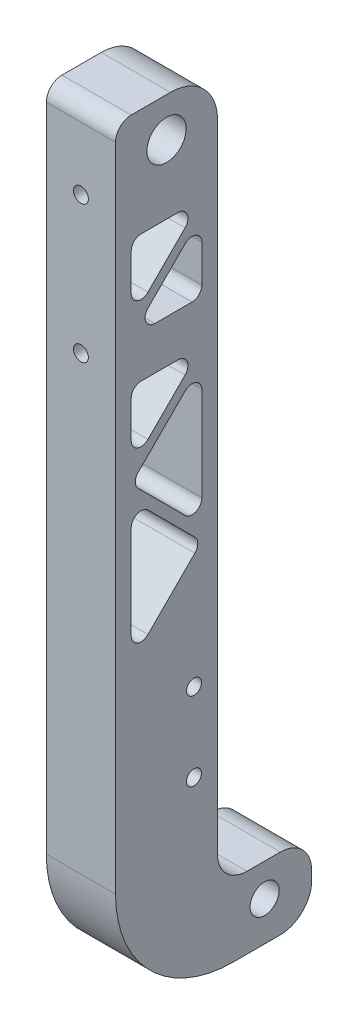
from build123d import *

# Parameters (mm, degrees)
SKETCH3_W               = 50.8
SKETCH3_H               = 254
BOSS_EXTRUDE1_DEPTH     = 25.4
SKETCH4_R               = 4.7117
CUT_EXTRUDE1_DEPTH      = 246.225128402
SKETCH5_R               = 2.413
CUT_EXTRUDE2_DEPTH      = 246.225128402
SKETCH6_W               = 45.72
SKETCH6_H               = 85.725
CUT_EXTRUDE3_DEPTH      = 246.225128402
SKETCH7_W               = 15.24
SKETCH7_H               = 85.725
CUT_EXTRUDE4_DEPTH      = 1.4986
SKETCH8_W               = 15.24
SKETCH8_H               = 85.725
CUT_EXTRUDE5_DEPTH      = 1.4986
SKETCH9_W               = 30.48
SKETCH9_H               = 230.759
CUT_EXTRUDE6_DEPTH      = 246.225128402
FILLET5_R               = 6.35
SKETCH14_W              = 25.4
SKETCH14_H              = 254
BOSS_EXTRUDE2_DEPTH     = 12.7
FILLET8_R               = 38.1
FILLET9_R               = 9.525
FILLET10_R              = 10.16
FILLET11_R              = 15.24
FILLET12_R              = 5.08
SKETCH18_R              = 2.413
CUT_EXTRUDE8_DEPTH      = 251.804904258
CUT_EXTRUDE9_DEPTH      = 248.386090151
FILLET13_R              = 3.175
SKETCH20_R              = 6.35
CUT_EXTRUDE10_DEPTH     = 248.386090151
CUT_EXTRUDE11_START     = -254
CUT_EXTRUDE11_OUTLINE_W = 1.4986
CUT_EXTRUDE11_OUTLINE_H = 63.5
CUT_EXTRUDE11_DEPTH     = 254


# Read off the part's stored shape, not the designer's step: Cut-Extrude11
with BuildPart() as part:
    # Sketch3 → Boss-Extrude1 (new body)
    with BuildSketch(Plane(origin=(0, 0, 0), x_dir=(0, 0, -1), z_dir=(1, 0, 0))):
        with Locations((-10.16, 114.3)):
            Rectangle(SKETCH3_W, SKETCH3_H)
    extrude(amount=BOSS_EXTRUDE1_DEPTH)

    # Sketch4 → Cut-Extrude1 (cut, through all)
    with BuildSketch(Plane(origin=(0, 0, 0), x_dir=(0, 0, -1), z_dir=(1, 0, 0))):
        Circle(SKETCH4_R)
    extrude(amount=CUT_EXTRUDE1_DEPTH, mode=Mode.SUBTRACT)

    # Sketch5 → Cut-Extrude2 (cut, through all)
    with BuildSketch(Plane(origin=(0, 0, 0), x_dir=(0, 0, -1), z_dir=(1, 0, 0))):
        with Locations((-22.86, 70.866)):
            Circle(SKETCH5_R)
        with Locations((-22.86, 45.466)):
            Circle(SKETCH5_R)
    extrude(amount=CUT_EXTRUDE2_DEPTH, mode=Mode.SUBTRACT)

    # Sketch6 → Cut-Extrude3 (cut, through all)
    with BuildSketch(Plane(origin=(0, 0, 0), x_dir=(0, 0, -1), z_dir=(1, 0, 0))):
        with Locations((7.62, 53.4035)):
            Rectangle(SKETCH6_W, SKETCH6_H)
    extrude(amount=CUT_EXTRUDE3_DEPTH, mode=Mode.SUBTRACT)

    # Sketch7 → Cut-Extrude4 (cut)
    with BuildSketch(Plane(origin=(25.4, 0, 0), x_dir=(0, 0, -1), z_dir=(1, 0, 0))):
        with Locations((-22.86, 53.4035)):
            Rectangle(SKETCH7_W, SKETCH7_H)
    extrude(amount=-CUT_EXTRUDE4_DEPTH, mode=Mode.SUBTRACT)

    # Sketch8 → Cut-Extrude5 (cut)
    with BuildSketch(Plane.ZY):
        with Locations((22.86, 53.4035)):
            Rectangle(SKETCH8_W, SKETCH8_H)
    extrude(amount=-CUT_EXTRUDE5_DEPTH, mode=Mode.SUBTRACT)

    # Sketch9 → Cut-Extrude6 (cut, through all)
    with BuildSketch(Plane(origin=(25.4, 0, 0), x_dir=(0, 0, -1), z_dir=(1, 0, 0))):
        with Locations((0, 125.9205)):
            Rectangle(SKETCH9_W, SKETCH9_H)
    extrude(amount=-CUT_EXTRUDE6_DEPTH, mode=Mode.SUBTRACT)

    # Fillet5
    fillet5_edges = [part.edges().sort_by_distance(p)[0] for p in [
        (24.6507, 10.541, 30.48),
        (24.6507, 96.266, 30.48),
        (0.7493, 96.266, 30.48),
        (0.7493, 10.541, 30.48),
    ]]
    fillet(fillet5_edges, radius=FILLET5_R)

    # Sketch14 → Boss-Extrude2 (add)
    with BuildSketch(Plane.XY.offset(35.56)):
        with Locations((12.7, 114.3)):
            Rectangle(SKETCH14_W, SKETCH14_H)
    extrude(amount=BOSS_EXTRUDE2_DEPTH)

    # Fillet8
    fillet8_edges = [part.edges().sort_by_distance(p)[0] for p in [
        (12.7, -12.7, 48.26),
    ]]
    fillet(fillet8_edges, radius=FILLET8_R)

    # Fillet9
    fillet9_edges = [part.edges().sort_by_distance(p)[0] for p in [
        (12.7, 10.541, 15.24),
    ]]
    fillet(fillet9_edges, radius=FILLET9_R)

    # Fillet10
    fillet10_edges = [part.edges().sort_by_distance(p)[0] for p in [
        (12.7, 10.541, -15.24),
        (12.7, -12.7, -15.24),
    ]]
    fillet(fillet10_edges, radius=FILLET10_R)

    # Fillet11
    fillet11_edges = [part.edges().sort_by_distance(p)[0] for p in [
        (12.7, 241.3, 15.24),
    ]]
    fillet(fillet11_edges, radius=FILLET11_R)

    # Fillet12
    fillet12_edges = [part.edges().sort_by_distance(p)[0] for p in [
        (12.7, 241.3, 48.26),
    ]]
    fillet(fillet12_edges, radius=FILLET12_R)

    # Sketch18 → Cut-Extrude8 (cut, through all)
    with BuildSketch(Plane.XY.offset(48.26)):
        with Locations((12.7, 215.9)):
            Circle(SKETCH18_R)
        with Locations((12.7, 171.45)):
            Circle(SKETCH18_R)
    extrude(amount=-CUT_EXTRUDE8_DEPTH, mode=Mode.SUBTRACT)

    # Sketch19 → Cut-Extrude9 (cut, through all)
    with BuildSketch(Plane(origin=(25.4, 0, 0), x_dir=(0, 0, -1), z_dir=(1, 0, 0))):
        Polygon((-20.32, 110.399743879), (-43.18, 133.259743879), (-43.18, 110.399743879), (-43.18, 87.539743879), align=None)
        Polygon((-43.18, 137.749871939), (-20.32, 114.889871939), (-20.32, 160.609871939), align=None)
        Polygon((-43.18, 165.1), (-20.32, 165.1), (-43.18, 142.24), align=None)
        Polygon((-43.18, 206.375), (-20.32, 206.375), (-43.18, 183.515), align=None)
        Polygon((-43.18, 179.024871939), (-20.32, 201.884871939), (-20.32, 179.024871939), align=None)
    extrude(amount=-CUT_EXTRUDE9_DEPTH, mode=Mode.SUBTRACT)

    # Fillet13
    fillet13_edges = [part.edges().sort_by_distance(p)[0] for p in [
        (12.7, 87.539743879, 43.18),
        (12.7, 133.259743879, 43.18),
        (12.7, 110.399743879, 20.32),
        (12.7, 137.749871939, 43.18),
        (12.7, 160.609871939, 20.32),
        (12.7, 114.889871939, 20.32),
        (12.7, 142.24, 43.18),
        (12.7, 165.1, 43.18),
        (12.7, 165.1, 20.32),
        (12.7, 183.515, 43.18),
        (12.7, 206.375, 43.18),
        (12.7, 206.375, 20.32),
        (12.7, 179.024871939, 20.32),
        (12.7, 179.024871939, 43.18),
        (12.7, 201.884871939, 20.32),
    ]]
    fillet(fillet13_edges, radius=FILLET13_R)

    # Sketch20 → Cut-Extrude10 (cut, through all)
    with BuildSketch(Plane(origin=(25.4, 0, 0), x_dir=(0, 0, -1), z_dir=(1, 0, 0))):
        with Locations((-31.75, 228.6)):
            Circle(SKETCH20_R)
    extrude(amount=-CUT_EXTRUDE10_DEPTH, mode=Mode.SUBTRACT)

    # Cut-Extrude11 outline → Cut-Extrude11 (cut)
    with BuildSketch(Plane.XZ.offset(12.7).offset(CUT_EXTRUDE11_START)):
        with Locations((24.6507, 16.51)):
            Rectangle(CUT_EXTRUDE11_OUTLINE_W, CUT_EXTRUDE11_OUTLINE_H)
        with Locations((0.7493, 16.51)):
            Rectangle(CUT_EXTRUDE11_OUTLINE_W, CUT_EXTRUDE11_OUTLINE_H)
    extrude(amount=CUT_EXTRUDE11_DEPTH, mode=Mode.SUBTRACT)


solid = part.part
